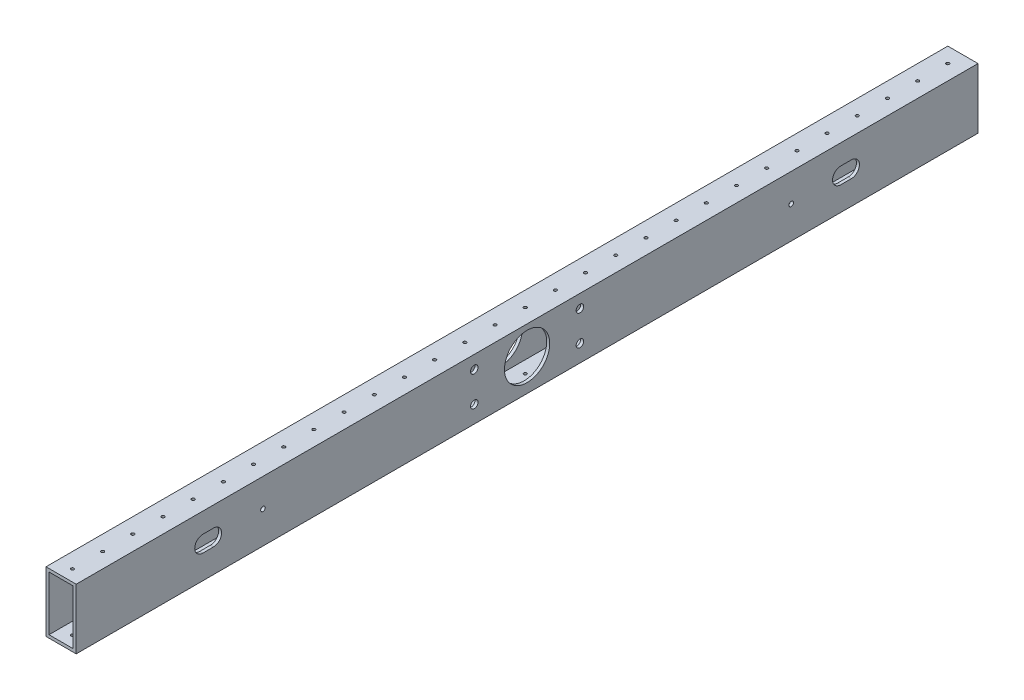
from build123d import *

# Parameters (mm, degrees)
SKETCH1_W           = 25.4
SKETCH1_H           = 50.8
SKETCH1_W_2         = 20.32
SKETCH1_H_2         = 45.72
EXTRUDE_THIN1_DEPTH = 379.4125
SKETCH2_R           = 1.27
CUT_EXTRUDE1_DEPTH  = 384.008844749
LPATTERN1_COUNT     = 30
LPATTERN1_PITCH     = 25.4
SKETCH4_R           = 19.05
SKETCH4_R_2         = 1.9304
CUT_EXTRUDE2_DEPTH  = 382.109124997
SKETCH5_R           = 3.175
CUT_EXTRUDE3_DEPTH  = 382.109124997


with BuildPart() as part:
    # Sketch1 → Extrude-Thin1 (new, symmetric)
    with BuildSketch(Plane.XY):
        Rectangle(SKETCH1_W, SKETCH1_H)
        Rectangle(SKETCH1_W_2, SKETCH1_H_2, mode=Mode.SUBTRACT)
    extrude(amount=EXTRUDE_THIN1_DEPTH, both=True)

    # Sketch2 → Cut-Extrude1 (cut, through all)
    with BuildSketch(Plane(origin=(0, 25.4, 0), x_dir=(1, 0, 0), z_dir=(0, 1, 0))):
        with Locations((0, 366.7125)):
            Circle(SKETCH2_R)
    cut_extrude1 = extrude(amount=-CUT_EXTRUDE1_DEPTH, mode=Mode.SUBTRACT)

    # LPattern1: Cut-Extrude1 ×30
    with Locations(*[(0, 0, i * LPATTERN1_PITCH) for i in range(1, LPATTERN1_COUNT)]):
        add(cut_extrude1, mode=Mode.SUBTRACT)

    # Sketch4 → Cut-Extrude2 (cut, through all)
    with BuildSketch(Plane.ZY.offset(12.7)):
        with Locations((0, 1.651)):
            Circle(SKETCH4_R)
        with Locations((-222.25, 1.651)):
            Circle(SKETCH4_R_2)
        with Locations((222.25, 1.651)):
            Circle(SKETCH4_R_2)
        with BuildLine():
            Line((263.906, 8.509), (272.796, 8.509))
            ThreePointArc((272.796, 8.509), (279.654, 1.651), (272.796, -5.207))
            Line((272.796, -5.207), (263.906, -5.207))
            ThreePointArc((263.906, -5.207), (257.048, 1.651), (263.906, 8.509))
        make_face()
        with BuildLine():
            Line((-263.906, 8.509), (-272.796, 8.509))
            ThreePointArc((-272.796, 8.509), (-279.654, 1.651), (-272.796, -5.207))
            Line((-272.796, -5.207), (-263.906, -5.207))
            ThreePointArc((-263.906, -5.207), (-257.048, 1.651), (-263.906, 8.509))
        make_face()
    extrude(amount=-CUT_EXTRUDE2_DEPTH, mode=Mode.SUBTRACT)

    # Sketch5 → Cut-Extrude3 (cut, through all)
    with BuildSketch(Plane.ZY.offset(12.7)):
        with Locations((-44.45, 14.351)):
            Circle(SKETCH5_R)
        with Locations((-44.45, -11.049)):
            Circle(SKETCH5_R)
        with Locations((44.45, 14.351)):
            Circle(SKETCH5_R)
        with Locations((44.45, -11.049)):
            Circle(SKETCH5_R)
    extrude(amount=-CUT_EXTRUDE3_DEPTH, mode=Mode.SUBTRACT)


solid = part.part
